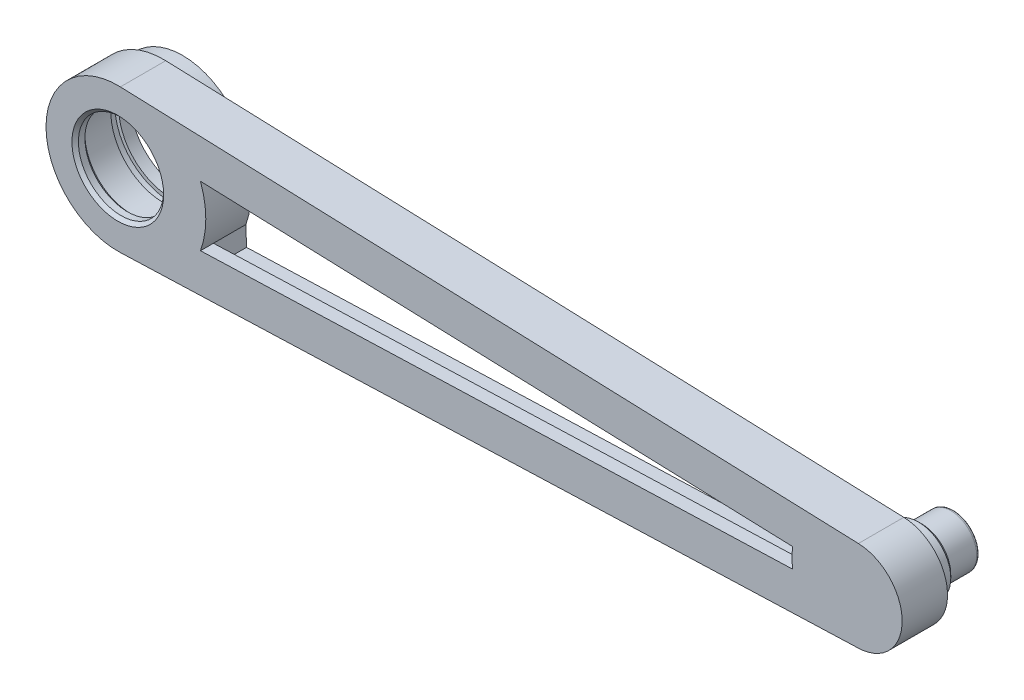
from build123d import *

# Parameters (mm, degrees)
SKETCH_1_R          = 8.075
EXTRUDE_1_DEPTH     = 7
EXTRUDE_START       = -2
SKETCH_2_R          = 8.075
SKETCH_2_R_2        = 6.575
EXTRUDE_2_DEPTH     = 2
SKETCH_3_R          = 4
EXTRUDE_3_DEPTH     = 10
SKETCH_4_R          = 5
SKETCH_4_R_2        = 4
EXTRUDE_4_DEPTH     = 3
CHAMFER_1_SIZE      = 0.5
CUT_EXTRUDE_1_DEPTH = 7
CUT_EXTRUDE_2_DEPTH = 5
CUT_EXTRUDE_START   = -2
SKETCH_8_R          = 4
CUT_EXTRUDE_3_DEPTH = 2
FILLET_1_R          = 0.5
SKETCH_9_R          = 2.2
CUT_EXTRUDE_4_DEPTH = 10
EXTRUDE_START_2     = 3
SKETCH_10_R         = 10.075
SKETCH_10_R_2       = 8.075
EXTRUDE_5_DEPTH     = 3


with BuildPart() as part:
    # 草图1 → 凸台-拉伸1 (new body)
    with BuildSketch(Plane.XY):
        with BuildLine():
            ThreePointArc((0.395882675, 11.067922204), (-11.074999998, -0.000217919), (0.396318234, -11.067906616))
            Line((0.396318234, -11.067906616), (114, -7))
            ThreePointArc((114, -7), (120.998881523, -0.125129643), (114.250219298, 6.995526449))
            Line((114.250219298, 6.995526449), (0.395882675, 11.067922204))
        make_face()
        Circle(SKETCH_1_R, mode=Mode.SUBTRACT)
    extrude(amount=EXTRUDE_1_DEPTH)

    # 草图2 → 凸台-拉伸2 (add)
    with BuildSketch(Plane.XY.offset(7).offset(EXTRUDE_START)):
        Circle(SKETCH_2_R)
        Circle(SKETCH_2_R_2, mode=Mode.SUBTRACT)
    extrude(amount=EXTRUDE_2_DEPTH)

    # 草图3 → 凸台-拉伸3 (add)
    with BuildSketch(Plane(origin=(0, 0, 0), x_dir=(-1, 0, 0), z_dir=(0, 0, -1))):
        with Locations((-114, 0)):
            Circle(SKETCH_3_R)
    extrude(amount=EXTRUDE_3_DEPTH)

    # 草图4 → 凸台-拉伸4 (add)
    with BuildSketch(Plane(origin=(0, 0, 0), x_dir=(-1, 0, 0), z_dir=(0, 0, -1))):
        with Locations(Location((-114, 0, 0), (0, 0, 180))):
            Circle(SKETCH_4_R)
        with Locations((-114, 0)):
            Circle(SKETCH_4_R_2, mode=Mode.SUBTRACT)
    extrude(amount=EXTRUDE_4_DEPTH)

    # 倒角1
    chamfer_1_edges = [part.edges().sort_by_distance(p)[0] for p in [
        (-6.575, 0, 5),
        (-6.575, 0, 7),
        (118, 0, -10),
        (109, 0, -3),
    ]]
    chamfer(chamfer_1_edges, length=CHAMFER_1_SIZE)

    # 草图5 → 切除-拉伸1 (cut)
    with BuildSketch(Plane(origin=(0, 0, 0), x_dir=(-1, 0, 0), z_dir=(0, 0, -1))):
        with BuildLine():
            ThreePointArc((-12.757234161, -4.640431182), (-13.574999998, 0.000234775), (-12.757073645, 4.640872443))
            Line((-12.757073645, 4.640872443), (-104.114755838, 1.510611753))
            ThreePointArc((-104.114755838, 1.510611753), (-104.028730231, 0.75748214), (-104, 0))
            ThreePointArc((-104, 0), (-104.028593207, -0.755676237), (-104.114209315, -1.507031033))
            Line((-104.114209315, -1.507031033), (-12.757234161, -4.640431182))
        make_face()
    extrude(amount=-CUT_EXTRUDE_1_DEPTH, mode=Mode.SUBTRACT)

    # 草图6 → 切除-拉伸2 (cut)
    with BuildSketch(Plane(origin=(0, 0, 0), x_dir=(-1, 0, 0), z_dir=(0, 0, -1))):
        Polygon((-104.114209315, -1.507031033), (-12.757234161, -4.640431182), (-12.860068961, -7.638668165), (-104.217044114, -4.505268015), align=None)
        Polygon((-12.757073645, 4.640872443), (-104.114755838, 1.510611753), (-104.217486931, 4.508852291), (-12.859804737, 7.63911298), align=None)
    extrude(amount=-CUT_EXTRUDE_2_DEPTH, mode=Mode.SUBTRACT)

    # 草图8 → 切除-拉伸3 (cut)
    with BuildSketch(Plane(origin=(0, 0, -10), x_dir=(-1, 0, 0), z_dir=(0, 0, -1)).offset(CUT_EXTRUDE_START)):
        with Locations((-114, 0)):
            Circle(SKETCH_8_R)
    extrude(amount=CUT_EXTRUDE_3_DEPTH, mode=Mode.SUBTRACT)

    # 圆角1
    fillet_1_edges = [part.edges().sort_by_distance(p)[0] for p in [
        (118, 0, -8),
    ]]
    fillet(fillet_1_edges, radius=FILLET_1_R)

    # 草图9 → 切除-拉伸4 (cut)
    with BuildSketch(Plane(origin=(0, 0, -8), x_dir=(-1, 0, 0), z_dir=(0, 0, -1))):
        with Locations((-114, 0)):
            Circle(SKETCH_9_R)
    extrude(amount=-CUT_EXTRUDE_4_DEPTH, mode=Mode.SUBTRACT)

    # 草图10 → 凸台-拉伸5 (add)
    with BuildSketch(Plane(origin=(0, 0, 0), x_dir=(-1, 0, 0), z_dir=(0, 0, -1)).offset(EXTRUDE_START_2)):
        with Locations(Location((0, 0, 0), (0, 0, 180))):
            Circle(SKETCH_10_R)
        Circle(SKETCH_10_R_2, mode=Mode.SUBTRACT)
    extrude(amount=-EXTRUDE_5_DEPTH)

    # 切除-旋转2: read off the stored shape, not the designer's step
    # 切除-旋转2: loft between two sections, ruled curve by curve
    cut_revolve_2_from = [
        Edge.make_three_point_arc((8.65, 0, -1.2), (0, 8.65, -1.2), (-8.65, 0, -1.2)),
        Edge.make_three_point_arc((-8.65, 0, -1.2), (0, -8.65, -1.2), (8.65, 0, -1.2)),
    ]
    cut_revolve_2_to = [
        Edge.make_three_point_arc((8.65, 0, 0), (0, 8.65, 0), (-8.65, 0, 0)),
        Edge.make_three_point_arc((-8.65, 0, 0), (0, -8.65, 0), (8.65, 0, 0)),
    ]
    cut_revolve_2 = Solid(Shell([*[Face.make_surface_from_curves(cut_revolve_2_from[k], cut_revolve_2_to[k]) for k in range(2)], Face(Wire(cut_revolve_2_from)), Face(Wire(cut_revolve_2_to))]))
    add(cut_revolve_2, mode=Mode.SUBTRACT)


solid = part.part
